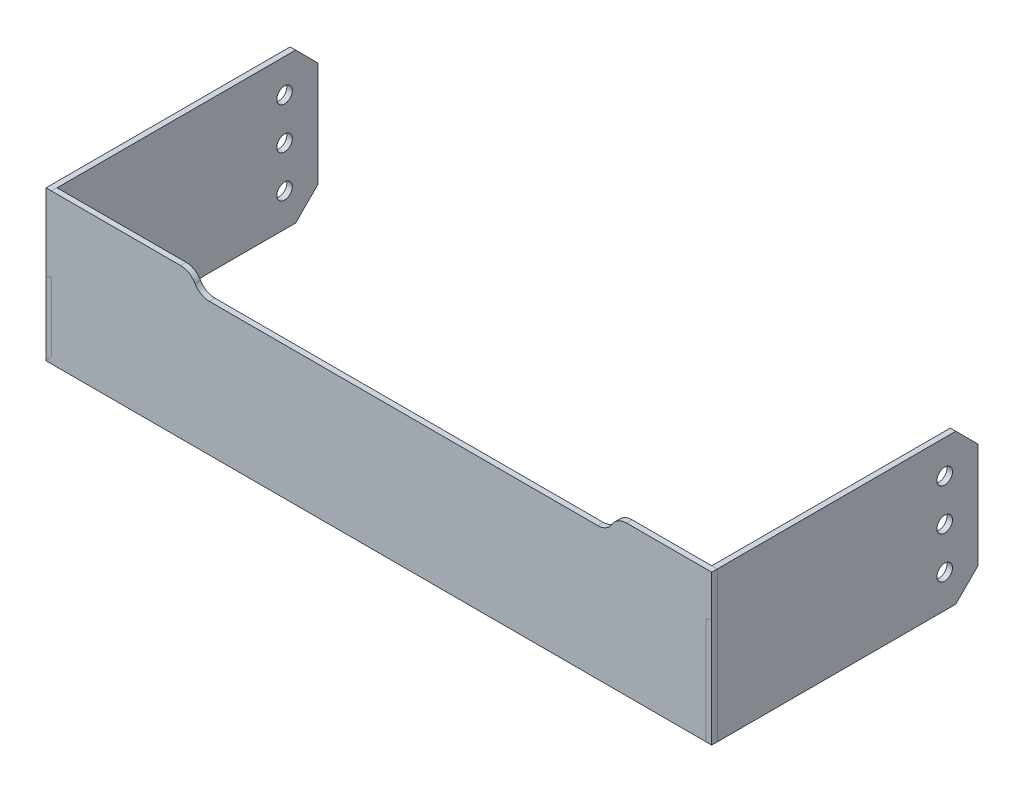
from build123d import *

# Parameters (mm, degrees)
BOSS_EXTRUDE1_DEPTH = 1
SKETCH3_W           = 48
SKETCH3_H           = 27
BASE_FLANGE1_DEPTH  = 1
CHAMFER1_SIZE       = 4
FILLET1_R           = 3
FILLET2_R           = 3
SKETCH8_W           = 48
SKETCH8_H           = 27
BASE_FLANGE2_DEPTH  = 1
CHAMFER2_SIZE       = 4
SKETCH11_R          = 1.4
CUT_EXTRUDE1_DEPTH  = 131.660656096


# Sheet-metal steps are written as plain solids
with BuildPart() as part:
    # Sketch1 → Boss-Extrude1 (new body)
    with BuildSketch(Plane.XY):
        Polygon((-53.246318657, -5.477755158), (66.753681343, -5.477755158), (66.753681343, 21.522244842), (49.207118364, 21.522244842), (49.207118364, 18.522244842), (-26.792881636, 18.522244842), (-26.792881636, 21.522244842), (-53.246318657, 21.522244842), align=None)
    extrude(amount=BOSS_EXTRUDE1_DEPTH)

    # Fillet1
    fillet1_edges = [part.edges().sort_by_distance(p)[0] for p in [
        (-26.792881636, 18.522244842, 0.5),
        (49.207118364, 18.522244842, 0.5),
    ]]
    fillet(fillet1_edges, radius=FILLET1_R - 0.0001)  # a hair under: the kernel refuses the full size

    # Fillet2
    fillet2_edges = [part.edges().sort_by_distance(p)[0] for p in [
        (-26.792881636, 21.522244842, 0.5),
        (49.207118364, 21.522244842, 0.5),
    ]]
    fillet(fillet2_edges, radius=FILLET2_R)


with BuildPart() as body_2:
    # Sketch3 → Base-Flange1 (new body)
    with BuildSketch(Plane(origin=(66.753681343, 0, 0), x_dir=(0, 0, -1), z_dir=(1, 0, 0))):
        with Locations((23, 8.022244842)):
            Rectangle(SKETCH3_W, SKETCH3_H)
    extrude(amount=-BASE_FLANGE1_DEPTH)

    # Chamfer1
    chamfer1_edges = [body_2.edges().sort_by_distance(p)[0] for p in [
        (66.253681343, 21.522244842, -47),
        (66.253681343, -5.477755158, -47),
    ]]
    chamfer(chamfer1_edges, length=CHAMFER1_SIZE)


with BuildPart() as body_3:
    # Sketch8 → Base-Flange2 (new body)
    with BuildSketch(Plane.ZY.offset(53.246318657)):
        with Locations((-23, 8.022244842)):
            Rectangle(SKETCH8_W, SKETCH8_H)
    extrude(amount=-BASE_FLANGE2_DEPTH)

    # Chamfer2
    chamfer2_edges = [body_3.edges().sort_by_distance(p)[0] for p in [
        (-52.746318657, -5.477755158, -47),
        (-52.746318657, 21.522244842, -47),
    ]]
    chamfer(chamfer2_edges, length=CHAMFER2_SIZE)


with BuildPart() as cut_extrude1_tool:
    # Sketch11 → Cut-Extrude1 (new, through all)
    with BuildSketch(Plane.ZY.offset(53.246318657)):
        with Locations((-41, 15.522244842)):
            Circle(SKETCH11_R)
        with Locations((-41, 8.022244842)):
            Circle(SKETCH11_R)
        with Locations((-41, 0.522244842)):
            Circle(SKETCH11_R)
    extrude(amount=-CUT_EXTRUDE1_DEPTH)


with BuildPart() as body_2_1:
    add(body_2.part)

    # Cut-Extrude1: cut by cut_extrude1_tool
    add(cut_extrude1_tool.part, mode=Mode.SUBTRACT)


with BuildPart() as body_3_1:
    add(body_3.part)

    # Cut-Extrude1: cut by cut_extrude1_tool
    add(cut_extrude1_tool.part, mode=Mode.SUBTRACT)


solid = Compound([part.part, body_2_1.part, body_3_1.part])
